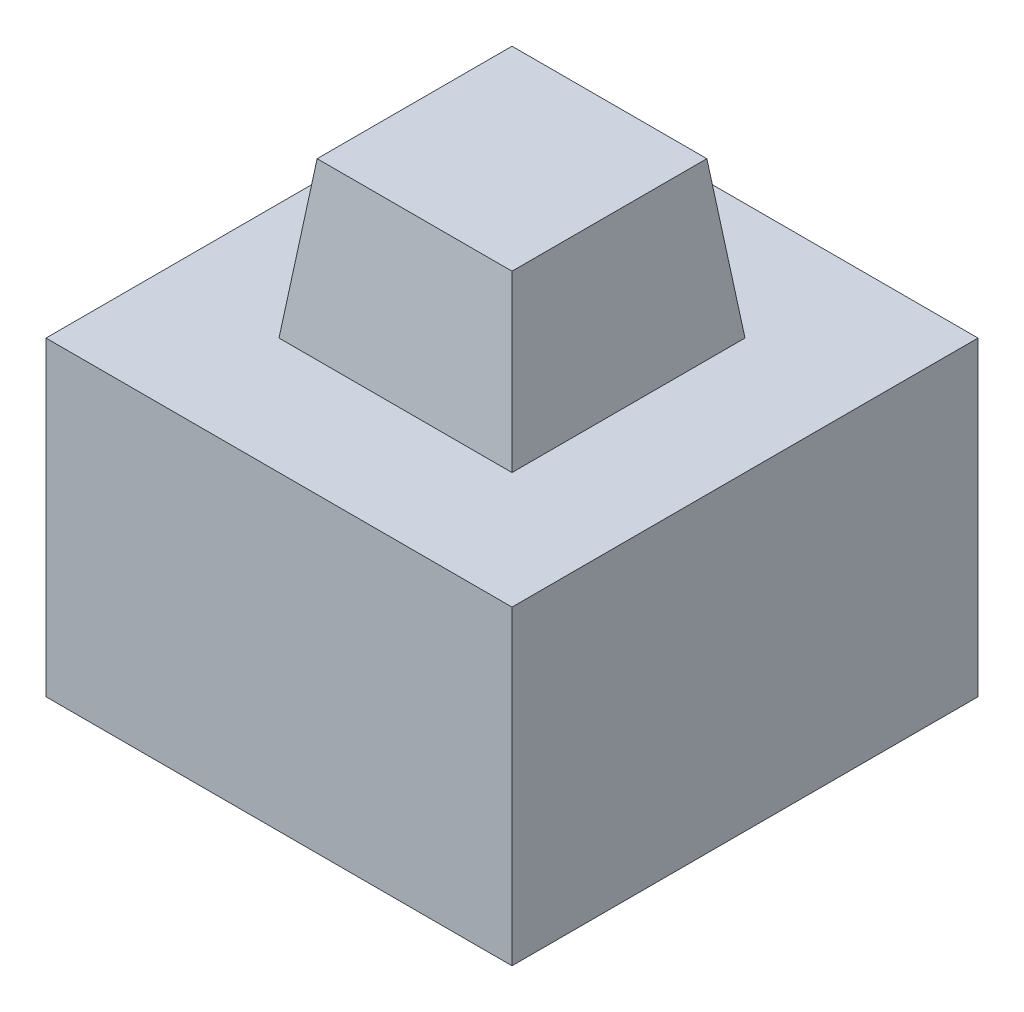
from build123d import *

# Parameters (mm, degrees)
SKETCH1_W           = 60
SKETCH1_H           = 60
BOSS_EXTRUDE1_DEPTH = 40
SKETCH2_W           = 30
SKETCH2_H           = 30
BOSS_EXTRUDE2_DEPTH = 20
BOSS_EXTRUDE2_TAPER = 5
DRAFT1_START        = -16
DRAFT1_DEPTH        = 32
DRAFT1_2_DEPTH      = 32


with BuildPart() as part:
    # Sketch1 → Boss-Extrude1 (new body)
    with BuildSketch(Plane(origin=(0, 0, 0), x_dir=(1, 0, 0), z_dir=(0, 1, 0))):
        Rectangle(SKETCH1_W, SKETCH1_H)
    extrude(amount=BOSS_EXTRUDE1_DEPTH)

    # Sketch2 → Boss-Extrude2 (add)
    with BuildSketch(Plane(origin=(0, 40, 0), x_dir=(1, 0, 0), z_dir=(0, 1, 0))):
        Rectangle(SKETCH2_W, SKETCH2_H)
    extrude(amount=BOSS_EXTRUDE2_DEPTH, taper=BOSS_EXTRUDE2_TAPER)

    # Draft1: read off the stored shape, not the designer's step
    # Draft1 outline → Draft1 (cut)
    with BuildSketch(Plane.XY.offset(DRAFT1_START)):
        Polygon((-15, 40), (-12.544308782, 60), (-13.250226729, 60), align=None)
        Polygon((12.544308782, 60), (15, 40), (13.250226729, 60), align=None)
    extrude(amount=DRAFT1_DEPTH, mode=Mode.SUBTRACT)

    # Draft1 2 outline → Draft1 2 (cut)
    with BuildSketch(Plane.YZ.offset(DRAFT1_START)):
        Polygon((60, -12.544308782), (40, -15), (60, -13.250226729), align=None)
        Polygon((60, 13.250226729), (40, 15), (60, 12.544308782), align=None)
    extrude(amount=DRAFT1_2_DEPTH, mode=Mode.SUBTRACT)


solid = part.part
